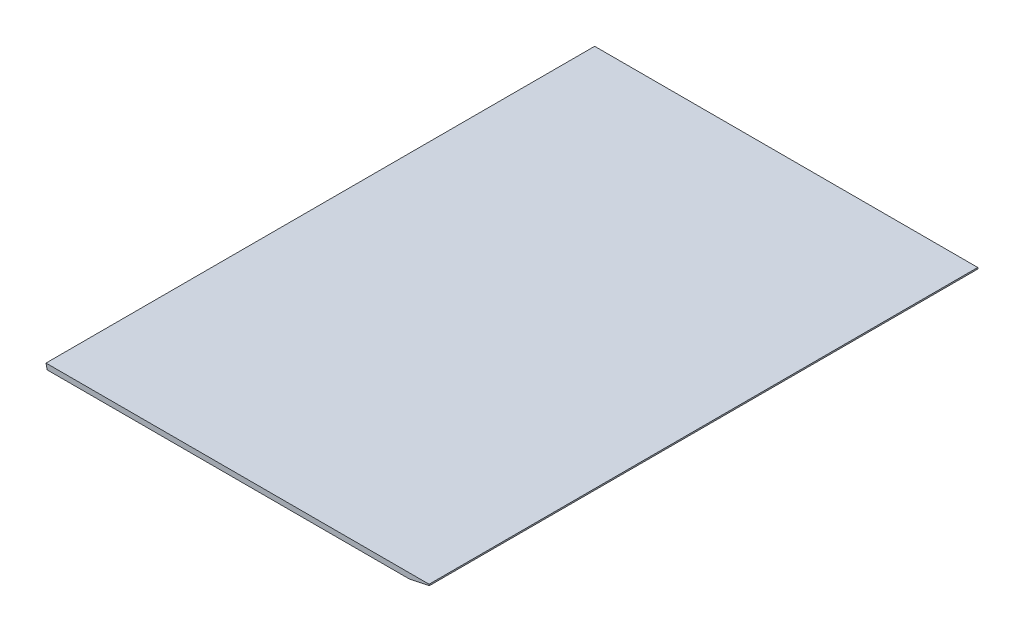
from build123d import *

# Parameters (mm, degrees)
SKETCH2_W              = 864.108
SKETCH2_H              = 1219.2
BOSS_EXTRUDE1_DEPTH    = 11.90625
CHAMFER6_SIZE2         = 2.530751562
CHAMFER6_SIZE          = 11.90625
CHAMFER7_SIZE2         = 11.90625
CHAMFER7_SIZE          = 56.014502241
CUT_EXTRUDE1_START     = 412.535124419
CUT_EXTRUDE1_OUTLINE_W = 6
CUT_EXTRUDE1_OUTLINE_H = 1222
CUT_EXTRUDE1_DEPTH     = 12.581416982


# Read off the part's stored shape, not the designer's step: Cut-Extrude1
with BuildPart() as part:
    # Sketch2 → Boss-Extrude1 (new body)
    with BuildSketch(Plane(origin=(0, 0, 0), x_dir=(1, 0, 0), z_dir=(0, 1, 0))):
        Rectangle(SKETCH2_W, SKETCH2_H)
    extrude(amount=BOSS_EXTRUDE1_DEPTH)

    # Chamfer6
    chamfer6_edges = [part.edges().sort_by_distance(p)[0] for p in [
        (-432.054, 0, 0),
    ]]
    chamfer6_side = [part.faces().sort_by_distance(p)[0] for p in [
        (-432.054, 0.050615031, 0),
    ]]
    chamfer(chamfer6_edges, length=CHAMFER6_SIZE - 0.0001, length2=CHAMFER6_SIZE2 - 0.0001, reference=chamfer6_side[0])  # a hair under: the kernel refuses the full size

    # Chamfer7
    chamfer7_edges = [part.edges().sort_by_distance(p)[0] for p in [
        (432.054, 0, 0),
    ]]
    chamfer7_side = [part.faces().sort_by_distance(p)[0] for p in [
        (431.815875, 0, 0),
    ]]
    chamfer(chamfer7_edges, length=CHAMFER7_SIZE - 0.0001, length2=CHAMFER7_SIZE2 - 0.0001, reference=chamfer7_side[0])  # a hair under: the kernel refuses the full size

    # Cut-Extrude1 outline → Cut-Extrude1 (cut)
    with BuildSketch(Plane(origin=(0, 0, 0), x_dir=(-0.20755464226928605, 0.978223425640824, 0), z_dir=(0.9782234256408241, 0.20755464226928602, 0)).offset(CUT_EXTRUDE1_START)):
        with Locations((-77, 0)):
            Rectangle(CUT_EXTRUDE1_OUTLINE_W, CUT_EXTRUDE1_OUTLINE_H)
    extrude(amount=CUT_EXTRUDE1_DEPTH, mode=Mode.SUBTRACT)


solid = part.part
